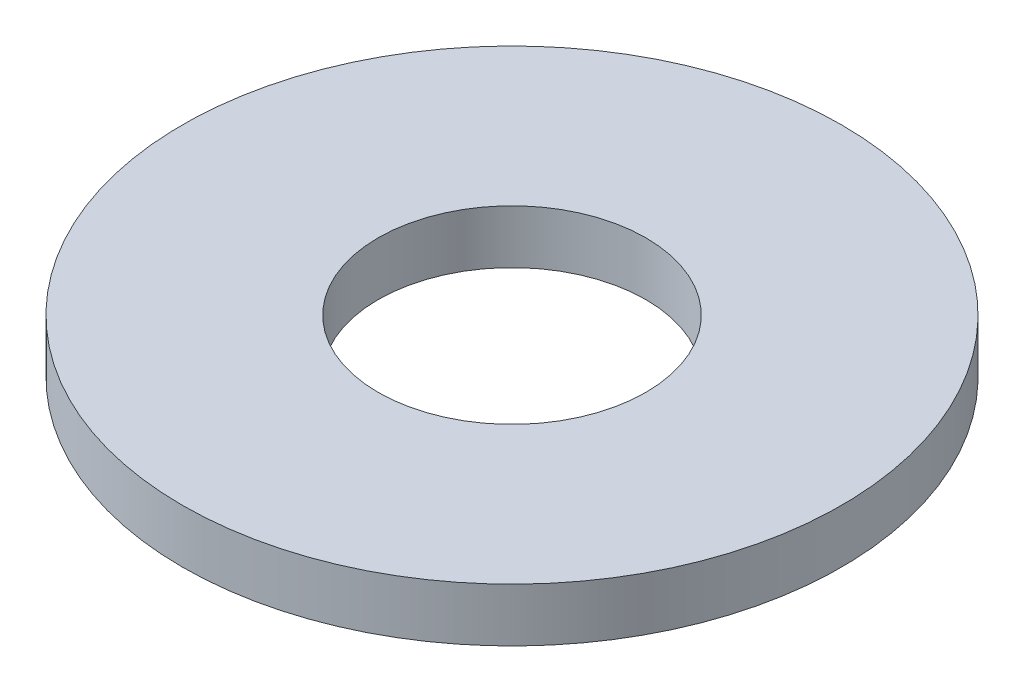
from build123d import *

# Parameters (mm, degrees)
SKETCH1_R           = 80
BOSS_EXTRUDE1_DEPTH = 13
SKETCH2_R           = 32.5
CUT_EXTRUDE1_DEPTH  = 114.881517377


with BuildPart() as part:
    # Sketch1 → Boss-Extrude1 (new body)
    with BuildSketch(Plane(origin=(0, 0, 0), x_dir=(1, 0, 0), z_dir=(0, 1, 0))):
        Circle(SKETCH1_R)
    extrude(amount=BOSS_EXTRUDE1_DEPTH)

    # Sketch2 → Cut-Extrude1 (cut, through all)
    with BuildSketch(Plane(origin=(0, 0, 0), x_dir=(1, 0, 0), z_dir=(0, 1, 0))):
        Circle(SKETCH2_R)
    extrude(amount=CUT_EXTRUDE1_DEPTH, mode=Mode.SUBTRACT)


solid = part.part
